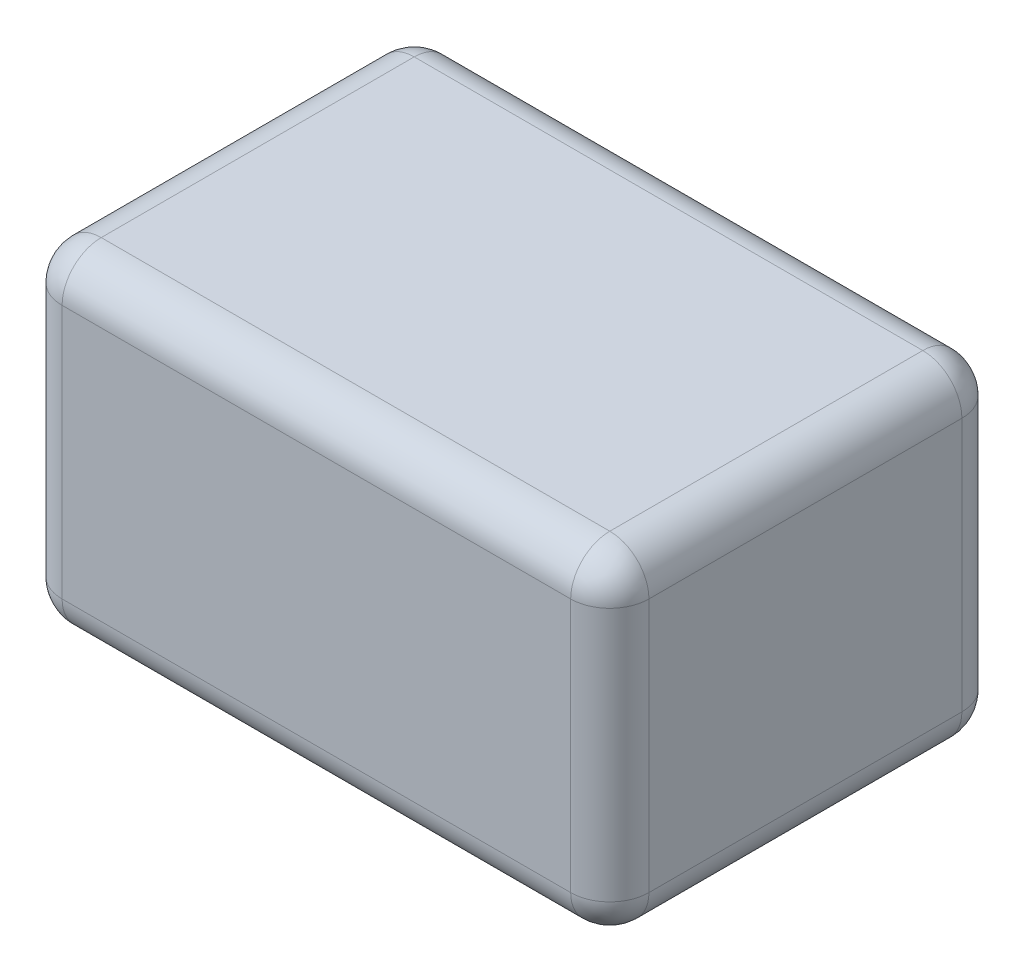
from build123d import *

# Parameters (mm, degrees)
SKETCH1_W           = 60
SKETCH1_H           = 40
BOSS_EXTRUDE1_DEPTH = 34
FILLET1_R           = 4


with BuildPart() as part:
    # Sketch1 → Boss-Extrude1 (new body)
    with BuildSketch(Plane(origin=(0, 0, 0), x_dir=(1, 0, 0), z_dir=(0, 1, 0))):
        Rectangle(SKETCH1_W, SKETCH1_H)
    extrude(amount=BOSS_EXTRUDE1_DEPTH)

    # Fillet1
    fillet1_edges = [part.edges().sort_by_distance(p)[0] for p in [
        (30, 17, 20),
        (0, 34, 20),
        (30, 34, 0),
        (-30, 34, 0),
        (-30, 17, 20),
        (-30, 0, 0),
        (0, 0, 20),
        (30, 0, 0),
        (30, 17, -20),
        (0, 34, -20),
        (-30, 17, -20),
        (0, 0, -20),
    ]]
    fillet(fillet1_edges, radius=FILLET1_R)


solid = part.part
